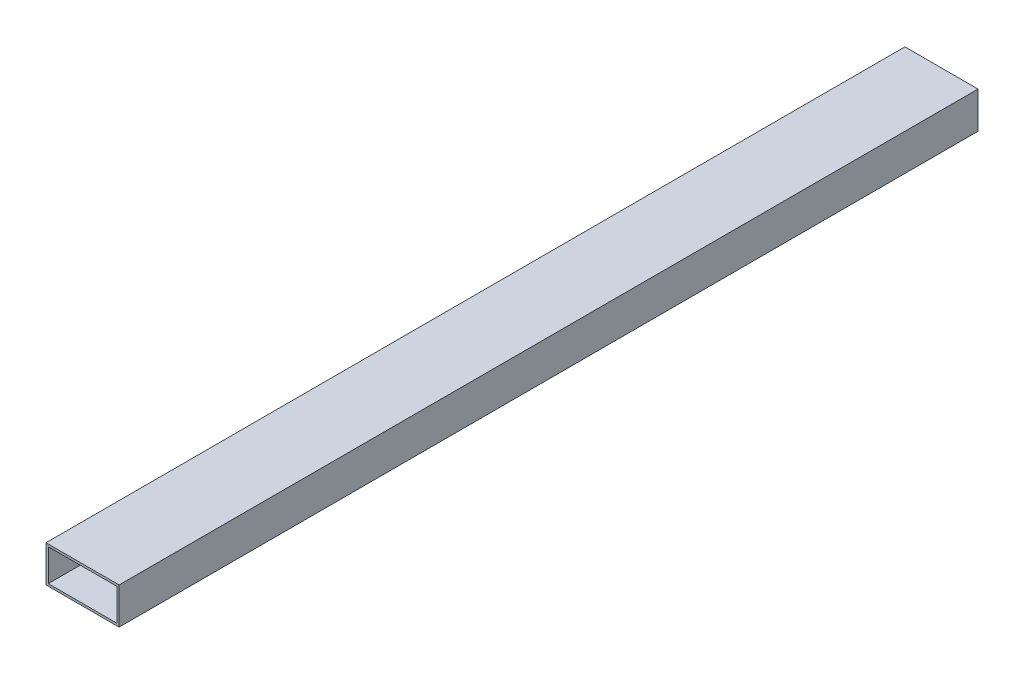
from build123d import *

# Parameters (mm, degrees)
SKETCH1_W           = 50.8
SKETCH1_H           = 25.4
BOSS_EXTRUDE1_DEPTH = 298.45
SHELL1_T            = -1.5875


with BuildPart() as part:
    # Sketch1 → Boss-Extrude1 (new, symmetric)
    with BuildSketch(Plane.XY):
        with Locations((25.4, 12.7)):
            Rectangle(SKETCH1_W, SKETCH1_H)
    extrude(amount=BOSS_EXTRUDE1_DEPTH, both=True)

    # Shell1
    shell1_openings = [part.faces().sort_by_distance(p)[0] for p in [
        (25.4, 12.7, -298.45),
        (25.4, 12.7, 298.45),
    ]]
    offset(amount=SHELL1_T, openings=shell1_openings, kind=Kind.INTERSECTION)


solid = part.part
